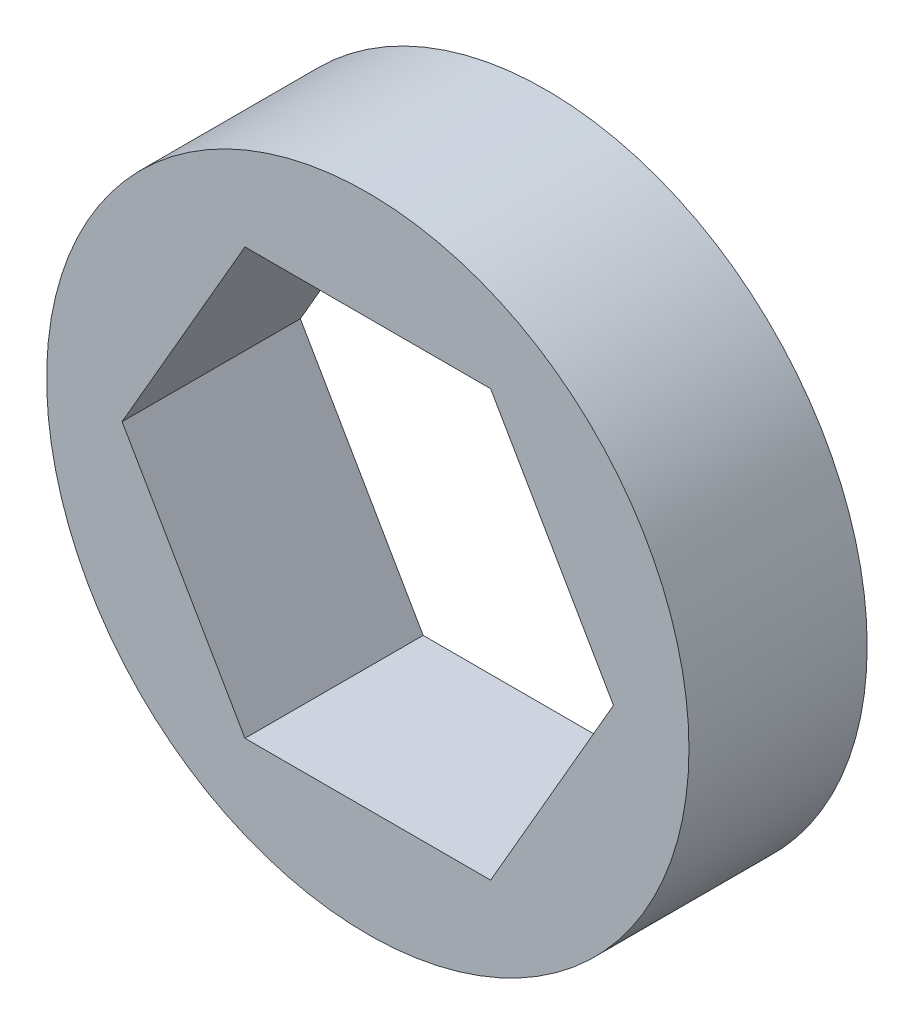
from build123d import *

# Parameters (mm, degrees)
SKETCH1_R           = 10.16
BOSS_EXTRUDE1_DEPTH = 5.63753
CUT_EXTRUDE1_DEPTH  = 0.4


with BuildPart() as part:
    # Sketch1 → Boss-Extrude1 (new body)
    with BuildSketch(Plane.XY):
        Circle(SKETCH1_R)
        Polygon((3.886144662, 6.731), (-3.886144662, 6.731), (-7.772289324, 0), (-3.886144662, -6.731), (3.886144662, -6.731), (7.772289324, 0), align=None, mode=Mode.SUBTRACT)
    extrude(amount=BOSS_EXTRUDE1_DEPTH)

    # Sketch2 → Cut-Extrude1 (cut)
    # profile 1 of 4: a face of its own
    with BuildSketch(Plane(origin=(0, 0, 0), x_dir=(-1, 0, 0), z_dir=(0, 0, -1))):
        with BuildLine():
            add(Edge.make_bspline(
                [(-2.473143607, 8.159113982), (-2.472994827, 8.184558155), (-2.472705821, 8.233983826), (-2.469490715, 8.306004003), (-2.464149757, 8.373568134), (-2.456830305, 8.436679453), (-2.447923079, 8.495354254), (-2.436032483, 8.549435733), (-2.422510247, 8.599174197), (-2.406838245, 8.644731841), (-2.389154498, 8.686722442), (-2.36990753, 8.725922444), (-2.348333498, 8.762272534), (-2.325665398, 8.796352889), (-2.300985637, 8.827605637), (-2.274996543, 8.85647213), (-2.246683763, 8.88228522), (-2.217009756, 8.905801222), (-2.18570586, 8.926415804), (-2.153664365, 8.94457351), (-2.120664727, 8.960085593), (-2.086616851, 8.972282326), (-2.051826763, 8.982356532), (-2.016172843, 8.989245804), (-1.979596225, 8.993580545), (-1.954907681, 8.993994959), (-1.942386896, 8.994205128)],
                knots=[0, 0, 0, 0, 1.646270934, 3.197905019, 4.663502075, 6.030701355, 7.308322542, 8.50163776, 9.611534131, 10.641858119, 11.616356847, 12.558055219, 13.465016945, 14.349605745, 15.204443733, 16.039544428, 16.859896111, 17.680448484, 18.487036065, 19.28249412, 20.06191084, 20.843045899, 21.620316918, 22.403196591, 23.190181807, 24, 24, 24, 24], degree=3))
            add(Edge.make_bspline(
                [(-1.942386896, 8.994205128), (-1.929761518, 8.993983869), (-1.904653614, 8.993543855), (-1.867533158, 8.989314781), (-1.831270267, 8.982297521), (-1.79601954, 8.972354793), (-1.761491421, 8.960019612), (-1.727955979, 8.944558669), (-1.69520491, 8.926561469), (-1.663758672, 8.90541421), (-1.633272043, 8.881836535), (-1.60449386, 8.855183467), (-1.577421503, 8.82572413), (-1.551715204, 8.793773713), (-1.528104272, 8.758719407), (-1.50561918, 8.7211709), (-1.485493292, 8.680471543), (-1.466110064, 8.637300403), (-1.449379181, 8.590462957), (-1.434290563, 8.540223227), (-1.422099031, 8.485987792), (-1.411943896, 8.428041209), (-1.404076747, 8.366170672), (-1.398346942, 8.300508808), (-1.395320221, 8.231012416), (-1.394750217, 8.183497249), (-1.394457709, 8.159113982)],
                knots=[0, 0, 0, 0, 0.810914788, 1.612654377, 2.396697861, 3.181598691, 3.963628158, 4.749916497, 5.551656086, 6.361998678, 7.18212741, 8.025565596, 8.878627764, 9.750805457, 10.657531673, 11.591944965, 12.560506719, 13.57287815, 14.630710178, 15.753379473, 16.941251878, 18.199788006, 19.531962791, 20.947069417, 22.433333509, 24, 24, 24, 24], degree=3))
            add(Edge.make_bspline(
                [(-1.394457709, 8.159113982), (-1.39475325, 8.134837067), (-1.395329097, 8.087534487), (-1.398313011, 8.018350795), (-1.404190676, 7.953037397), (-1.411543063, 7.891437651), (-1.421726179, 7.833807946), (-1.434247093, 7.779948857), (-1.448149204, 7.729627795), (-1.465309986, 7.683257006), (-1.484092701, 7.640189617), (-1.50452845, 7.599972732), (-1.526422264, 7.562250878), (-1.550275017, 7.527325993), (-1.575699243, 7.494950673), (-1.603239097, 7.465696394), (-1.632118256, 7.438858268), (-1.662694601, 7.414976994), (-1.694631269, 7.394074244), (-1.727269851, 7.375380819), (-1.761189457, 7.360307418), (-1.795621403, 7.347364738), (-1.831058198, 7.337476676), (-1.867455668, 7.330639606), (-1.904628675, 7.325844518), (-1.929757242, 7.325478722), (-1.942386896, 7.325294872)],
                knots=[0, 0, 0, 0, 1.561518951, 3.042555995, 4.452378317, 5.7783523, 7.031515105, 8.214008947, 9.334062868, 10.386615937, 11.391082383, 12.354592575, 13.286541444, 14.194233754, 15.072674879, 15.931287219, 16.775624067, 17.606195743, 18.42308326, 19.229000347, 20.022332153, 20.807536673, 21.593273796, 22.3848459, 23.188221202, 24, 24, 24, 24], degree=3))
            add(Edge.make_bspline(
                [(-1.942386896, 7.325294872), (-1.954907334, 7.325506397), (-1.979595192, 7.325923484), (-2.016176828, 7.330238641), (-2.051683508, 7.337176244), (-2.086290443, 7.346890204), (-2.120175183, 7.358780505), (-2.152875999, 7.37427164), (-2.184756484, 7.39211245), (-2.215731583, 7.412430373), (-2.245219242, 7.435708422), (-2.273385395, 7.461455082), (-2.299522457, 7.490312843), (-2.32384935, 7.521826044), (-2.34696974, 7.555704765), (-2.36823742, 7.592411562), (-2.387909201, 7.631800889), (-2.405890355, 7.674127227), (-2.421832785, 7.720008213), (-2.435915138, 7.769968733), (-2.44703406, 7.824449753), (-2.456551329, 7.883013702), (-2.464227745, 7.945912235), (-2.469468457, 8.013179499), (-2.472707554, 8.084773575), (-2.472995603, 8.133881652), (-2.473143607, 8.159113982)],
                knots=[0, 0, 0, 0, 0.810891512, 1.598919785, 2.382837074, 3.152667961, 3.926044502, 4.706494248, 5.493654104, 6.291793342, 7.103789334, 7.925228297, 8.761435821, 9.622817696, 10.50288917, 11.416980706, 12.369136599, 13.353924996, 14.394355917, 15.514179734, 16.714354668, 17.994756427, 19.357759367, 20.818452758, 22.365282078, 24, 24, 24, 24], degree=3))
        make_face()
        with BuildLine():
            add(Edge.make_bspline(
                [(-2.330675658, 8.15975), (-2.33062148, 8.138546126), (-2.330516332, 8.09739357), (-2.327769412, 8.037593234), (-2.324027343, 7.981817406), (-2.319200755, 7.929995266), (-2.312032989, 7.882302225), (-2.304001696, 7.838410261), (-2.294228098, 7.798551657), (-2.282664286, 7.7624529), (-2.269492981, 7.729501359), (-2.255112108, 7.698839379), (-2.239663137, 7.670104751), (-2.222373379, 7.643555578), (-2.203543333, 7.619105282), (-2.183598319, 7.596321105), (-2.161793968, 7.576002474), (-2.13162977, 7.551633508), (-2.091807798, 7.526451615), (-2.04163352, 7.50452321), (-1.990076759, 7.490742596), (-1.955083156, 7.488990106), (-1.937616764, 7.488115385)],
                knots=[0, 0, 0, 0, 1.459021318, 2.831673884, 4.118529203, 5.306027144, 6.411944654, 7.436330062, 8.375795394, 9.233974572, 10.042671642, 10.816086306, 11.563610507, 12.285937304, 12.993564865, 13.685989202, 14.367179055, 15.041617293, 16.353048772, 17.594441528, 18.799311195, 20, 20, 20, 20], degree=3))
            add(Edge.make_bspline(
                [(-1.937616764, 7.488115385), (-1.920037391, 7.488840092), (-1.884914941, 7.490288012), (-1.833600684, 7.504257439), (-1.783784812, 7.525334694), (-1.744745039, 7.550257313), (-1.715044028, 7.573991948), (-1.693763822, 7.594227878), (-1.674232107, 7.616886432), (-1.655707309, 7.641333612), (-1.638716942, 7.668036489), (-1.623266876, 7.696866657), (-1.609168358, 7.727904177), (-1.601136041, 7.749571166), (-1.597029324, 7.760648938)],
                knots=[0, 0, 0, 0, 1.353760809, 2.704726607, 4.075137775, 5.516104923, 6.260822281, 7.007110065, 7.778089737, 8.566572457, 9.372053459, 10.217411131, 11.088608312, 12, 12, 12, 12], degree=3))
            add(Edge.make_bspline(
                [(-1.597029324, 7.760648938), (-1.592243344, 7.774813856), (-1.582525751, 7.803574713), (-1.570001839, 7.848189655), (-1.560138747, 7.89499948), (-1.551265363, 7.943724444), (-1.545208799, 7.99472388), (-1.540333898, 8.04783999), (-1.537462479, 8.103112822), (-1.537106538, 8.140666264), (-1.536925658, 8.15975)],
                knots=[0, 0, 0, 0, 0.884706709, 1.796334032, 2.740027952, 3.714592787, 4.726048262, 5.777819803, 6.87074269, 8, 8, 8, 8], degree=3))
            add(Edge.make_bspline(
                [(-1.536925658, 8.15975), (-1.537175208, 8.178830649), (-1.537663382, 8.216156477), (-1.539529369, 8.270820081), (-1.544347919, 8.322739386), (-1.549699662, 8.372138065), (-1.557590544, 8.418742667), (-1.56609855, 8.462943341), (-1.5775291, 8.504192499), (-1.58973914, 8.543135952), (-1.603713855, 8.579331249), (-1.619097063, 8.612947145), (-1.635526218, 8.64414593), (-1.653370735, 8.672842007), (-1.672418777, 8.699163911), (-1.693173093, 8.722583888), (-1.714810434, 8.743827798), (-1.7451168, 8.768076892), (-1.784792639, 8.79280184), (-1.834161915, 8.815555595), (-1.885538243, 8.828622213), (-1.920269774, 8.830464479), (-1.937616764, 8.831384615)],
                knots=[0, 0, 0, 0, 1.31362396, 2.569729283, 3.763502607, 4.902122613, 5.988968491, 7.01645872, 7.998833611, 8.933434873, 9.825090667, 10.667526885, 11.477055099, 12.250526234, 12.991942729, 13.710640831, 14.402115721, 15.076753259, 16.378508321, 17.609869233, 18.806226677, 20, 20, 20, 20], degree=3))
            add(Edge.make_bspline(
                [(-1.937616764, 8.831384615), (-1.955174782, 8.830463209), (-1.990322806, 8.828618718), (-2.042233128, 8.815604278), (-2.091991888, 8.792919826), (-2.131562809, 8.767995), (-2.161890312, 8.744255837), (-2.183245676, 8.723669838), (-2.203269119, 8.701151716), (-2.221714825, 8.676476562), (-2.238991036, 8.649958341), (-2.254857424, 8.621388437), (-2.269152784, 8.590622069), (-2.282344699, 8.557685328), (-2.293943785, 8.521589686), (-2.303511404, 8.481780178), (-2.312350174, 8.43802782), (-2.318607314, 8.390076471), (-2.324169803, 8.338241352), (-2.327744558, 8.282326283), (-2.330525521, 8.222425653), (-2.33062461, 8.18106032), (-2.330675658, 8.15975)],
                knots=[0, 0, 0, 0, 1.207732386, 2.417664972, 3.655092373, 4.956220595, 5.625982001, 6.301752483, 6.994047911, 7.697131622, 8.419323945, 9.170223765, 9.943494443, 10.752040957, 11.610060368, 12.549350801, 13.567764191, 14.679664412, 15.874934091, 17.154273443, 18.533957287, 20, 20, 20, 20], degree=3))
        make_face(mode=Mode.SUBTRACT)
    # profile 2 of 4: a face of its own
    with BuildSketch(Plane(origin=(0, 0, 0), x_dir=(-1, 0, 0), z_dir=(0, 0, -1))):
        with BuildLine():
            add(Edge.make_bspline(
                [(-1.251989761, 8.159113982), (-1.251840981, 8.184558155), (-1.251551974, 8.233983826), (-1.248336869, 8.306004003), (-1.24299591, 8.373568134), (-1.235676459, 8.436679453), (-1.226769232, 8.495354254), (-1.214878637, 8.549435733), (-1.201356401, 8.599174197), (-1.185684399, 8.644731841), (-1.168000652, 8.686722442), (-1.148753684, 8.725922444), (-1.127179652, 8.762272534), (-1.104511552, 8.796352889), (-1.079831791, 8.827605637), (-1.053842697, 8.85647213), (-1.025529917, 8.88228522), (-0.99585591, 8.905801222), (-0.964552013, 8.926415804), (-0.932510518, 8.94457351), (-0.899510881, 8.960085593), (-0.865463005, 8.972282326), (-0.830672917, 8.982356532), (-0.795018997, 8.989245804), (-0.758442378, 8.993580545), (-0.733753835, 8.993994959), (-0.72123305, 8.994205128)],
                knots=[0, 0, 0, 0, 1.646270934, 3.197905019, 4.663502075, 6.030701355, 7.308322542, 8.50163776, 9.611534131, 10.641858119, 11.616356847, 12.558055219, 13.465016945, 14.349605745, 15.204443733, 16.039544428, 16.859896111, 17.680448484, 18.487036065, 19.28249412, 20.06191084, 20.843045899, 21.620316918, 22.403196591, 23.190181807, 24, 24, 24, 24], degree=3))
            add(Edge.make_bspline(
                [(-0.72123305, 8.994205128), (-0.708607672, 8.993983869), (-0.683499768, 8.993543855), (-0.646379312, 8.989314781), (-0.610116421, 8.982297521), (-0.574865694, 8.972354793), (-0.540337575, 8.960019612), (-0.506802133, 8.944558669), (-0.474051064, 8.926561469), (-0.442604826, 8.90541421), (-0.412118197, 8.881836535), (-0.383340014, 8.855183467), (-0.356267657, 8.82572413), (-0.330561358, 8.793773713), (-0.306950426, 8.758719407), (-0.284465334, 8.7211709), (-0.264339446, 8.680471543), (-0.244956218, 8.637300403), (-0.228225335, 8.590462957), (-0.213136717, 8.540223227), (-0.200945184, 8.485987792), (-0.19079005, 8.428041209), (-0.182922901, 8.366170672), (-0.177193095, 8.300508808), (-0.174166375, 8.231012416), (-0.173596371, 8.183497249), (-0.173303863, 8.159113982)],
                knots=[0, 0, 0, 0, 0.810914788, 1.612654377, 2.396697861, 3.181598691, 3.963628158, 4.749916497, 5.551656086, 6.361998678, 7.18212741, 8.025565596, 8.878627764, 9.750805457, 10.657531673, 11.591944965, 12.560506719, 13.57287815, 14.630710178, 15.753379473, 16.941251878, 18.199788006, 19.531962791, 20.947069417, 22.433333509, 24, 24, 24, 24], degree=3))
            add(Edge.make_bspline(
                [(-0.173303863, 8.159113982), (-0.173599403, 8.134837067), (-0.174175251, 8.087534487), (-0.177159165, 8.018350795), (-0.18303683, 7.953037397), (-0.190389217, 7.891437651), (-0.200572333, 7.833807946), (-0.213093247, 7.779948857), (-0.226995358, 7.729627795), (-0.24415614, 7.683257006), (-0.262938855, 7.640189617), (-0.283374604, 7.599972732), (-0.305268418, 7.562250878), (-0.32912117, 7.527325993), (-0.354545397, 7.494950673), (-0.382085251, 7.465696394), (-0.41096441, 7.438858268), (-0.441540755, 7.414976994), (-0.473477423, 7.394074244), (-0.506116005, 7.375380819), (-0.540035611, 7.360307418), (-0.574467557, 7.347364738), (-0.609904352, 7.337476676), (-0.646301822, 7.330639606), (-0.683474829, 7.325844518), (-0.708603396, 7.325478722), (-0.72123305, 7.325294872)],
                knots=[0, 0, 0, 0, 1.561518951, 3.042555995, 4.452378317, 5.7783523, 7.031515105, 8.214008947, 9.334062868, 10.386615937, 11.391082383, 12.354592575, 13.286541444, 14.194233754, 15.072674879, 15.931287219, 16.775624067, 17.606195743, 18.42308326, 19.229000347, 20.022332153, 20.807536673, 21.593273796, 22.3848459, 23.188221202, 24, 24, 24, 24], degree=3))
            add(Edge.make_bspline(
                [(-0.72123305, 7.325294872), (-0.733753487, 7.325506397), (-0.758441346, 7.325923484), (-0.795022982, 7.330238641), (-0.830529662, 7.337176244), (-0.865136597, 7.346890204), (-0.899021337, 7.358780505), (-0.931722153, 7.37427164), (-0.963602638, 7.39211245), (-0.994577737, 7.412430373), (-1.024065396, 7.435708422), (-1.052231549, 7.461455082), (-1.078368611, 7.490312843), (-1.102695504, 7.521826044), (-1.125815894, 7.555704765), (-1.147083574, 7.592411562), (-1.166755355, 7.631800889), (-1.184736509, 7.674127227), (-1.200678939, 7.720008213), (-1.214761292, 7.769968733), (-1.225880213, 7.824449753), (-1.235397483, 7.883013702), (-1.243073899, 7.945912235), (-1.248314611, 8.013179499), (-1.251553707, 8.084773575), (-1.251841757, 8.133881652), (-1.251989761, 8.159113982)],
                knots=[0, 0, 0, 0, 0.810891512, 1.598919785, 2.382837074, 3.152667961, 3.926044502, 4.706494248, 5.493654104, 6.291793342, 7.103789334, 7.925228297, 8.761435821, 9.622817696, 10.50288917, 11.416980706, 12.369136599, 13.353924996, 14.394355917, 15.514179734, 16.714354668, 17.994756427, 19.357759367, 20.818452758, 22.365282078, 24, 24, 24, 24], degree=3))
        make_face()
        with BuildLine():
            add(Edge.make_bspline(
                [(-1.109521812, 8.15975), (-1.109467634, 8.138546126), (-1.109362486, 8.09739357), (-1.106615566, 8.037593234), (-1.102873497, 7.981817406), (-1.098046908, 7.929995266), (-1.090879142, 7.882302225), (-1.082847849, 7.838410261), (-1.073074252, 7.798551657), (-1.06151044, 7.7624529), (-1.048339135, 7.729501359), (-1.033958261, 7.698839379), (-1.018509291, 7.670104751), (-1.001219533, 7.643555578), (-0.982389487, 7.619105282), (-0.962444473, 7.596321105), (-0.940640122, 7.576002474), (-0.910475924, 7.551633508), (-0.870653952, 7.526451615), (-0.820479674, 7.50452321), (-0.768922912, 7.490742596), (-0.73392931, 7.488990106), (-0.716462918, 7.488115385)],
                knots=[0, 0, 0, 0, 1.459021318, 2.831673884, 4.118529203, 5.306027144, 6.411944654, 7.436330062, 8.375795394, 9.233974572, 10.042671642, 10.816086306, 11.563610507, 12.285937304, 12.993564865, 13.685989202, 14.367179055, 15.041617293, 16.353048772, 17.594441528, 18.799311195, 20, 20, 20, 20], degree=3))
            add(Edge.make_bspline(
                [(-0.716462918, 7.488115385), (-0.698883545, 7.488840092), (-0.663761095, 7.490288012), (-0.612446838, 7.504257439), (-0.562630966, 7.525334694), (-0.523591193, 7.550257313), (-0.493890182, 7.573991948), (-0.472609976, 7.594227878), (-0.453078261, 7.616886432), (-0.434553463, 7.641333612), (-0.417563096, 7.668036489), (-0.40211303, 7.696866657), (-0.388014512, 7.727904177), (-0.379982194, 7.749571166), (-0.375875478, 7.760648938)],
                knots=[0, 0, 0, 0, 1.353760809, 2.704726607, 4.075137775, 5.516104923, 6.260822281, 7.007110065, 7.778089737, 8.566572457, 9.372053459, 10.217411131, 11.088608312, 12, 12, 12, 12], degree=3))
            add(Edge.make_bspline(
                [(-0.375875478, 7.760648938), (-0.371089497, 7.774813856), (-0.361371905, 7.803574713), (-0.348847993, 7.848189655), (-0.338984901, 7.89499948), (-0.330111517, 7.943724444), (-0.324054953, 7.99472388), (-0.319180052, 8.04783999), (-0.316308633, 8.103112822), (-0.315952692, 8.140666264), (-0.315771812, 8.15975)],
                knots=[0, 0, 0, 0, 0.884706709, 1.796334032, 2.740027952, 3.714592787, 4.726048262, 5.777819803, 6.87074269, 8, 8, 8, 8], degree=3))
            add(Edge.make_bspline(
                [(-0.315771812, 8.15975), (-0.316021362, 8.178830649), (-0.316509535, 8.216156477), (-0.318375523, 8.270820081), (-0.323194073, 8.322739386), (-0.328545816, 8.372138065), (-0.336436698, 8.418742667), (-0.344944704, 8.462943341), (-0.356375253, 8.504192499), (-0.368585294, 8.543135952), (-0.382560009, 8.579331249), (-0.397943217, 8.612947145), (-0.414372372, 8.64414593), (-0.432216888, 8.672842007), (-0.45126493, 8.699163911), (-0.472019247, 8.722583888), (-0.493656588, 8.743827798), (-0.523962954, 8.768076892), (-0.563638793, 8.79280184), (-0.613008069, 8.815555595), (-0.664384397, 8.828622213), (-0.699115928, 8.830464479), (-0.716462918, 8.831384615)],
                knots=[0, 0, 0, 0, 1.31362396, 2.569729283, 3.763502607, 4.902122613, 5.988968491, 7.01645872, 7.998833611, 8.933434873, 9.825090667, 10.667526885, 11.477055099, 12.250526234, 12.991942729, 13.710640831, 14.402115721, 15.076753259, 16.378508321, 17.609869233, 18.806226677, 20, 20, 20, 20], degree=3))
            add(Edge.make_bspline(
                [(-0.716462918, 8.831384615), (-0.734020936, 8.830463209), (-0.76916896, 8.828618718), (-0.821079282, 8.815604278), (-0.870838042, 8.792919826), (-0.910408962, 8.767995), (-0.940736466, 8.744255837), (-0.96209183, 8.723669838), (-0.982115272, 8.701151716), (-1.000560979, 8.676476562), (-1.01783719, 8.649958341), (-1.033703578, 8.621388437), (-1.047998938, 8.590622069), (-1.061190853, 8.557685328), (-1.072789939, 8.521589686), (-1.082357558, 8.481780178), (-1.091196328, 8.43802782), (-1.097453468, 8.390076471), (-1.103015957, 8.338241352), (-1.106590711, 8.282326283), (-1.109371675, 8.222425653), (-1.109470764, 8.18106032), (-1.109521812, 8.15975)],
                knots=[0, 0, 0, 0, 1.207732386, 2.417664972, 3.655092373, 4.956220595, 5.625982001, 6.301752483, 6.994047911, 7.697131622, 8.419323945, 9.170223765, 9.943494443, 10.752040957, 11.610060368, 12.549350801, 13.567764191, 14.679664412, 15.874934091, 17.154273443, 18.533957287, 20, 20, 20, 20], degree=3))
        make_face(mode=Mode.SUBTRACT)
    # profile 3 of 4: a face of its own
    with BuildSketch(Plane(origin=(0, 0, 0), x_dir=(-1, 0, 0), z_dir=(0, 0, -1))):
        Polygon((0.835738104, 8.994205128), (0.864676906, 8.994205128), (0.864676906, 7.895166667), (1.047849983, 7.895166667), (1.047849983, 7.732346154), (0.864676906, 7.732346154), (0.864676906, 7.366), (0.722208957, 7.366), (0.722208957, 7.732346154), (-0.030835915, 7.732346154), align=None)
        Polygon((0.722208957, 7.895166667), (0.722208957, 8.584609776), (0.249011842, 7.895166667), align=None, mode=Mode.SUBTRACT)
    # profile 4 of 4: a face of its own
    with BuildSketch(Plane(origin=(0, 0, 0), x_dir=(-1, 0, 0), z_dir=(0, 0, -1))):
        with BuildLine():
            add(Edge.make_bspline(
                [(1.962125323, 8.250382512), (1.975119486, 8.243607082), (2.000462442, 8.230392731), (2.03655639, 8.20911532), (2.069542373, 8.18669031), (2.100335592, 8.164176903), (2.12839504, 8.140712904), (2.153406971, 8.116205008), (2.175989213, 8.091264954), (2.195686361, 8.06547042), (2.213011355, 8.038889932), (2.227984716, 8.011453726), (2.240783233, 7.983221928), (2.250926423, 7.953886366), (2.259282022, 7.923877962), (2.265031314, 7.892809234), (2.268123273, 7.860884908), (2.268707842, 7.839309286), (2.269003829, 7.828384816)],
                knots=[0, 0, 0, 0, 1.272397273, 2.481599622, 3.635517121, 4.734568067, 5.792894095, 6.808321871, 7.773003508, 8.711915296, 9.623354172, 10.525449501, 11.423591555, 12.311487226, 13.218079475, 14.126165749, 15.051214107, 16, 16, 16, 16], degree=3))
            add(Edge.make_bspline(
                [(2.269003829, 7.828384816), (2.268653935, 7.813100487), (2.267961363, 7.782847066), (2.26192887, 7.738194722), (2.252896912, 7.69482795), (2.239707276, 7.652756256), (2.222601559, 7.61221179), (2.201520994, 7.573159846), (2.177658055, 7.534960374), (2.158493646, 7.511456574), (2.148796497, 7.499563702)],
                knots=[0, 0, 0, 0, 1.025265484, 2.029385089, 3.018602448, 3.995076438, 4.983346944, 5.966715145, 6.97116228, 8, 8, 8, 8], degree=3))
            add(Edge.make_bspline(
                [(2.148796497, 7.499563702), (2.136170668, 7.48568724), (2.11107503, 7.458105792), (2.068084202, 7.42229596), (2.020902848, 7.39220177), (1.969713532, 7.367676304), (1.91465309, 7.348587361), (1.855733252, 7.334870219), (1.792839154, 7.32701326), (1.749611316, 7.325877522), (1.727434819, 7.325294872)],
                knots=[0, 0, 0, 0, 0.954267603, 1.896743057, 2.838368354, 3.796610408, 4.779680527, 5.799409237, 6.871065594, 8, 8, 8, 8], degree=3))
            add(Edge.make_bspline(
                [(1.727434819, 7.325294872), (1.706110889, 7.325817603), (1.664616687, 7.326834784), (1.604220078, 7.333726544), (1.5479214, 7.345804184), (1.495393308, 7.362334418), (1.446952472, 7.383838343), (1.402736922, 7.410602871), (1.362108728, 7.441550703), (1.326300863, 7.47757066), (1.294510747, 7.516150481), (1.266585237, 7.555952104), (1.243374138, 7.596979163), (1.223722205, 7.638619908), (1.208678138, 7.681457985), (1.198258599, 7.725272991), (1.191641303, 7.769988395), (1.19076086, 7.800165252), (1.190317932, 7.815346454)],
                knots=[0, 0, 0, 0, 1.256902934, 2.445805442, 3.576955095, 4.645999104, 5.686449165, 6.692658513, 7.68621702, 8.689161843, 9.678783111, 10.630372946, 11.551080876, 12.453998257, 13.34127905, 14.221779781, 15.105423033, 16, 16, 16, 16], degree=3))
            add(Edge.make_bspline(
                [(1.190317932, 7.815346454), (1.190580042, 7.826485802), (1.191098064, 7.848501085), (1.194683478, 7.881026388), (1.200447673, 7.91268392), (1.208276069, 7.943590615), (1.21888557, 7.973521463), (1.231695395, 8.002618285), (1.246632388, 8.03091393), (1.263904916, 8.058563137), (1.283999049, 8.085178487), (1.306751847, 8.11121167), (1.332618059, 8.136258732), (1.361309925, 8.160625689), (1.392499556, 8.184744791), (1.426997079, 8.207312568), (1.463887979, 8.229926716), (1.490106859, 8.243446921), (1.503556613, 8.250382512)],
                knots=[0, 0, 0, 0, 0.941657376, 1.861047343, 2.762797495, 3.66048619, 4.553285746, 5.444104102, 6.34607688, 7.256116206, 8.197091036, 9.162375105, 10.176350973, 11.237807142, 12.343728897, 13.50695164, 14.721116704, 16, 16, 16, 16], degree=3))
            add(Edge.make_bspline(
                [(1.503556613, 8.250382512), (1.485145526, 8.260422211), (1.449496506, 8.279861877), (1.402293581, 8.315579179), (1.361748549, 8.354263295), (1.328975873, 8.396731094), (1.303180255, 8.441655927), (1.285482531, 8.488756713), (1.27350984, 8.537160093), (1.272323829, 8.57022826), (1.271728188, 8.586835837)],
                knots=[0, 0, 0, 0, 1.166880483, 2.259407225, 3.286803203, 4.280235371, 5.237608625, 6.161067461, 7.076446754, 8, 8, 8, 8], degree=3))
            add(Edge.make_bspline(
                [(1.271728188, 8.586835837), (1.27246997, 8.603752944), (1.27396108, 8.637759279), (1.286018515, 8.688380628), (1.305667259, 8.73809957), (1.33239214, 8.786675125), (1.365678485, 8.832463259), (1.405613882, 8.873530045), (1.451244663, 8.909503467), (1.502343053, 8.939700517), (1.557332345, 8.964276677), (1.615351263, 8.981230461), (1.675388922, 8.992313986), (1.716254674, 8.993568861), (1.736975083, 8.994205128)],
                knots=[0, 0, 0, 0, 0.888701115, 1.786444228, 2.72001202, 3.692817113, 4.693886446, 5.687152267, 6.695133018, 7.739871481, 8.800368666, 9.853104506, 10.91144658, 12, 12, 12, 12], degree=3))
            add(Edge.make_bspline(
                [(1.736975083, 8.994205128), (1.757160742, 8.993549108), (1.796964562, 8.992255512), (1.855472839, 8.981466464), (1.911454837, 8.963446288), (1.964717503, 8.939000048), (2.014307314, 8.908888828), (2.058123362, 8.872421289), (2.096827783, 8.831535657), (2.128842847, 8.785761408), (2.155223872, 8.737372506), (2.173593924, 8.68674372), (2.185364998, 8.634968968), (2.186849702, 8.599936017), (2.187593573, 8.582383714)],
                knots=[0, 0, 0, 0, 1.072916533, 2.115669174, 3.151510826, 4.193348718, 5.225979165, 6.227137561, 7.216255879, 8.211077061, 9.189680878, 10.138522389, 11.067357538, 12, 12, 12, 12], degree=3))
            add(Edge.make_bspline(
                [(2.187593573, 8.582383714), (2.186942897, 8.565158584), (2.185665007, 8.531329409), (2.174915391, 8.482014165), (2.156811853, 8.435830598), (2.132094857, 8.392254652), (2.099879725, 8.352076615), (2.060596479, 8.314785573), (2.014558308, 8.280075191), (1.979968549, 8.26048709), (1.962125323, 8.250382512)],
                knots=[0, 0, 0, 0, 0.975232327, 1.915300861, 2.843280834, 3.77672583, 4.742871857, 5.749627742, 6.839139064, 8, 8, 8, 8], degree=3))
        make_face()
        with BuildLine():
            add(Edge.make_bspline(
                [(1.729024863, 8.831384615), (1.717889319, 8.831089141), (1.696103325, 8.830511063), (1.664158892, 8.827490895), (1.63378214, 8.821615686), (1.604655688, 8.813796699), (1.577178869, 8.803233933), (1.550978518, 8.79080834), (1.526500542, 8.77570166), (1.503449451, 8.758755688), (1.482698207, 8.74011712), (1.464281143, 8.72069804), (1.448983034, 8.700117059), (1.435992245, 8.678886124), (1.426566342, 8.656375113), (1.419506819, 8.633274186), (1.414734616, 8.609291423), (1.414377025, 8.592900934), (1.414196137, 8.584609776)],
                knots=[0, 0, 0, 0, 1.203892937, 2.355340988, 3.463153438, 4.544400666, 5.610487187, 6.640501085, 7.674077295, 8.714426146, 9.728707835, 10.68524104, 11.601827946, 12.495867327, 13.368432065, 14.231010473, 15.105153427, 16, 16, 16, 16], degree=3))
            add(Edge.make_bspline(
                [(1.414196137, 8.584609776), (1.414507907, 8.576318259), (1.415124009, 8.55993303), (1.419888835, 8.53573687), (1.426990337, 8.511959913), (1.438171173, 8.489167536), (1.451581628, 8.466569083), (1.468133119, 8.444729353), (1.487858499, 8.423572339), (1.510095946, 8.403277993), (1.534321893, 8.384273911), (1.559986798, 8.367776075), (1.586768555, 8.353972032), (1.614391993, 8.342483338), (1.643138646, 8.333552545), (1.672832368, 8.327216766), (1.703478149, 8.32327886), (1.724242913, 8.322808497), (1.734749021, 8.322570513)],
                knots=[0, 0, 0, 0, 0.873023192, 1.725219244, 2.590779336, 3.480155217, 4.391973325, 5.357036234, 6.360879153, 7.436073238, 8.526419356, 9.601555421, 10.645666583, 11.697338044, 12.750135903, 13.812665442, 14.89329948, 16, 16, 16, 16], degree=3))
            add(Edge.make_bspline(
                [(1.734749021, 8.322570513), (1.748242818, 8.32296642), (1.775097135, 8.323754325), (1.814684546, 8.331080036), (1.853175817, 8.342603435), (1.890159534, 8.358369562), (1.9246784, 8.378157913), (1.955448717, 8.401849318), (1.982208022, 8.428896733), (2.004678227, 8.458879091), (2.022099836, 8.490788561), (2.035662442, 8.522810837), (2.04358235, 8.555287563), (2.044615389, 8.577044007), (2.045125624, 8.587789864)],
                knots=[0, 0, 0, 0, 1.076279235, 2.141928126, 3.20205304, 4.278698113, 5.344010996, 6.36967002, 7.368914609, 8.37248503, 9.349703398, 10.264243087, 11.142681841, 12, 12, 12, 12], degree=3))
            add(Edge.make_bspline(
                [(2.045125624, 8.587789864), (2.04488437, 8.595331866), (2.044405517, 8.610301659), (2.04045942, 8.632407989), (2.033938953, 8.654011407), (2.025111056, 8.67529038), (2.013495184, 8.695946355), (1.999722857, 8.716304041), (1.982993101, 8.735905477), (1.964216861, 8.755207458), (1.942923765, 8.773070926), (1.919154848, 8.788780241), (1.893031968, 8.802120845), (1.864554509, 8.812956102), (1.833827347, 8.821094239), (1.800992007, 8.827188582), (1.765774704, 8.830623529), (1.741540496, 8.831125418), (1.729024863, 8.831384615)],
                knots=[0, 0, 0, 0, 0.814439003, 1.616544685, 2.417341072, 3.248991801, 4.09997495, 4.973547432, 5.9003056, 6.880240646, 7.880314356, 8.896779544, 9.951930927, 11.043077905, 12.18215768, 13.381699519, 14.647792085, 16, 16, 16, 16], degree=3))
        make_face(mode=Mode.SUBTRACT)
        with BuildLine():
            add(Edge.make_bspline(
                [(1.738247118, 8.15975), (1.724129351, 8.159498884), (1.696433737, 8.159006256), (1.65585863, 8.153522804), (1.616918088, 8.145889472), (1.579743402, 8.134309413), (1.544350272, 8.119252434), (1.510547099, 8.101139267), (1.478592479, 8.079728227), (1.448927671, 8.055291334), (1.421838875, 8.028957224), (1.398072503, 8.001079756), (1.377889699, 7.972177035), (1.361636761, 7.941881989), (1.348296439, 7.910836108), (1.339536216, 7.878266234), (1.333920226, 7.844798508), (1.333166104, 7.822047321), (1.33278588, 7.810576322)],
                knots=[0, 0, 0, 0, 1.140299081, 2.23698856, 3.303958914, 4.344563908, 5.37730929, 6.408454204, 7.439741482, 8.480804886, 9.510774543, 10.48932336, 11.43758569, 12.353841022, 13.263987381, 14.161954604, 15.073269652, 16, 16, 16, 16], degree=3))
            add(Edge.make_bspline(
                [(1.33278588, 7.810576322), (1.333404216, 7.796320161), (1.334630978, 7.768036271), (1.344363096, 7.726233735), (1.359982072, 7.685765614), (1.381764937, 7.646961692), (1.408737729, 7.610698608), (1.441905806, 7.579089771), (1.4792079, 7.551003957), (1.521906141, 7.528288858), (1.568546195, 7.510148335), (1.619115658, 7.497649737), (1.672888782, 7.489375937), (1.710017954, 7.48854219), (1.729024863, 7.488115385)],
                knots=[0, 0, 0, 0, 0.898778495, 1.783155532, 2.693654817, 3.627872908, 4.583023416, 5.533784346, 6.509005473, 7.520592997, 8.575161974, 9.658835044, 10.801527049, 12, 12, 12, 12], degree=3))
            add(Edge.make_bspline(
                [(1.729024863, 7.488115385), (1.743879494, 7.488400594), (1.772821079, 7.488956274), (1.815042206, 7.493861329), (1.854885983, 7.501639908), (1.892275145, 7.512953588), (1.927628244, 7.526764828), (1.960345872, 7.544532165), (1.991269704, 7.564739825), (2.018875931, 7.588714775), (2.044018851, 7.61433226), (2.065941452, 7.641451315), (2.084972198, 7.669334906), (2.099908739, 7.698613161), (2.111849575, 7.728724369), (2.120432759, 7.75994619), (2.125728757, 7.792374385), (2.126264377, 7.814372178), (2.12653588, 7.825522736)],
                knots=[0, 0, 0, 0, 1.224942928, 2.386581632, 3.501229538, 4.569074225, 5.605009692, 6.626002462, 7.634866581, 8.645888296, 9.63523824, 10.59253846, 11.518950513, 12.414518923, 13.29783783, 14.186679152, 15.080837789, 16, 16, 16, 16], degree=3))
            add(Edge.make_bspline(
                [(2.12653588, 7.825522736), (2.126125013, 7.836352816), (2.125314855, 7.857707841), (2.120172856, 7.889351944), (2.111139583, 7.919923935), (2.098744657, 7.949791616), (2.082243292, 7.978349811), (2.062810083, 8.006342503), (2.039363107, 8.032992748), (2.012868823, 8.058507545), (1.983994937, 8.082100397), (1.953303053, 8.102971232), (1.921029422, 8.120548084), (1.887242337, 8.134843066), (1.852016821, 8.146085954), (1.815378782, 8.153939995), (1.777285325, 8.158883743), (1.751406866, 8.159457986), (1.738247118, 8.15975)],
                knots=[0, 0, 0, 0, 0.917430815, 1.809013306, 2.70690318, 3.612392954, 4.541220862, 5.495268465, 6.494511384, 7.542276156, 8.608045339, 9.649016899, 10.681629292, 11.715607085, 12.752076957, 13.808767841, 14.885711793, 16, 16, 16, 16], degree=3))
        make_face(mode=Mode.SUBTRACT)
    extrude(amount=-CUT_EXTRUDE1_DEPTH, mode=Mode.SUBTRACT)


solid = part.part
